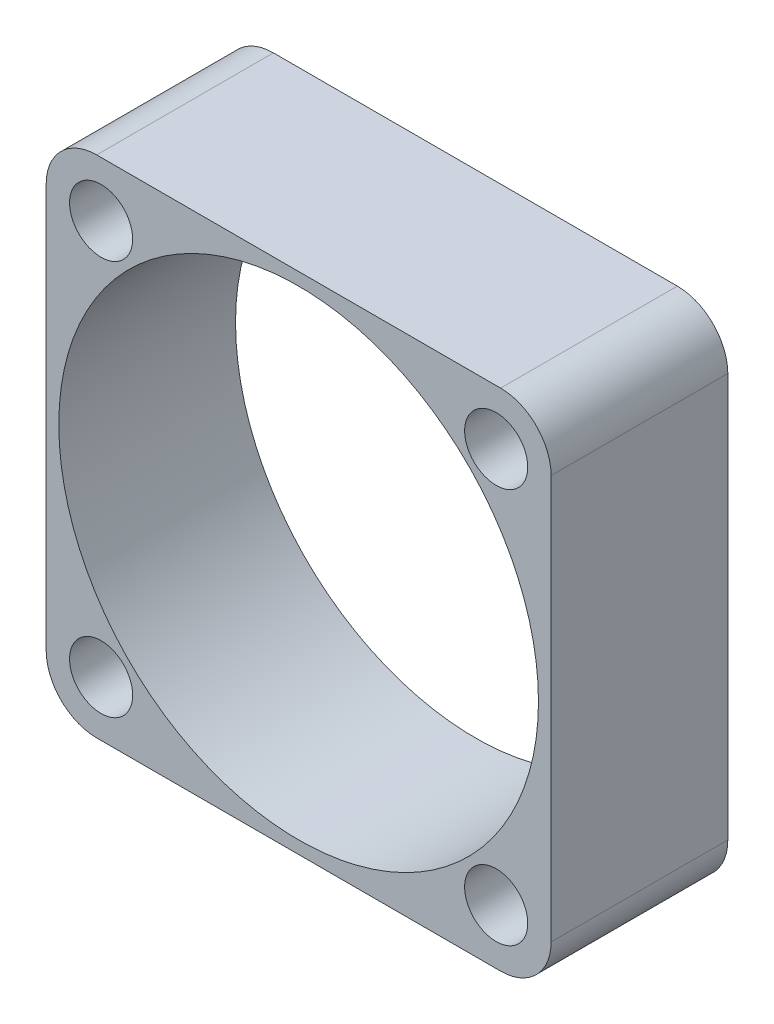
from build123d import *

# Parameters (mm, degrees)
SKETCH1_W           = 20
SKETCH1_H           = 20
SKETCH1_R           = 9.5
BOSS_EXTRUDE1_DEPTH = 7
FILLET1_R           = 2
SKETCH2_R           = 1.25
CUT_EXTRUDE1_DEPTH  = 16.779733838


with BuildPart() as part:
    # Sketch1 → Boss-Extrude1 (new body)
    with BuildSketch(Plane.XY):
        Rectangle(SKETCH1_W, SKETCH1_H)
        Circle(SKETCH1_R, mode=Mode.SUBTRACT)
    extrude(amount=BOSS_EXTRUDE1_DEPTH)

    # Fillet1
    fillet1_edges = [part.edges().sort_by_distance(p)[0] for p in [
        (-10, 10, 3.5),
        (-10, -10, 3.5),
        (10, -10, 3.5),
        (10, 10, 3.5),
    ]]
    fillet(fillet1_edges, radius=FILLET1_R)

    # Sketch2 → Cut-Extrude1 (cut, through all)
    with BuildSketch(Plane.XY.offset(7)):
        with Locations((-7.825, 7.825)):
            Circle(SKETCH2_R)
        with Locations((7.825, 7.825)):
            Circle(SKETCH2_R)
        with Locations((7.825, -7.825)):
            Circle(SKETCH2_R)
        with Locations((-7.825, -7.825)):
            Circle(SKETCH2_R)
    extrude(amount=-CUT_EXTRUDE1_DEPTH, mode=Mode.SUBTRACT)


solid = part.part
